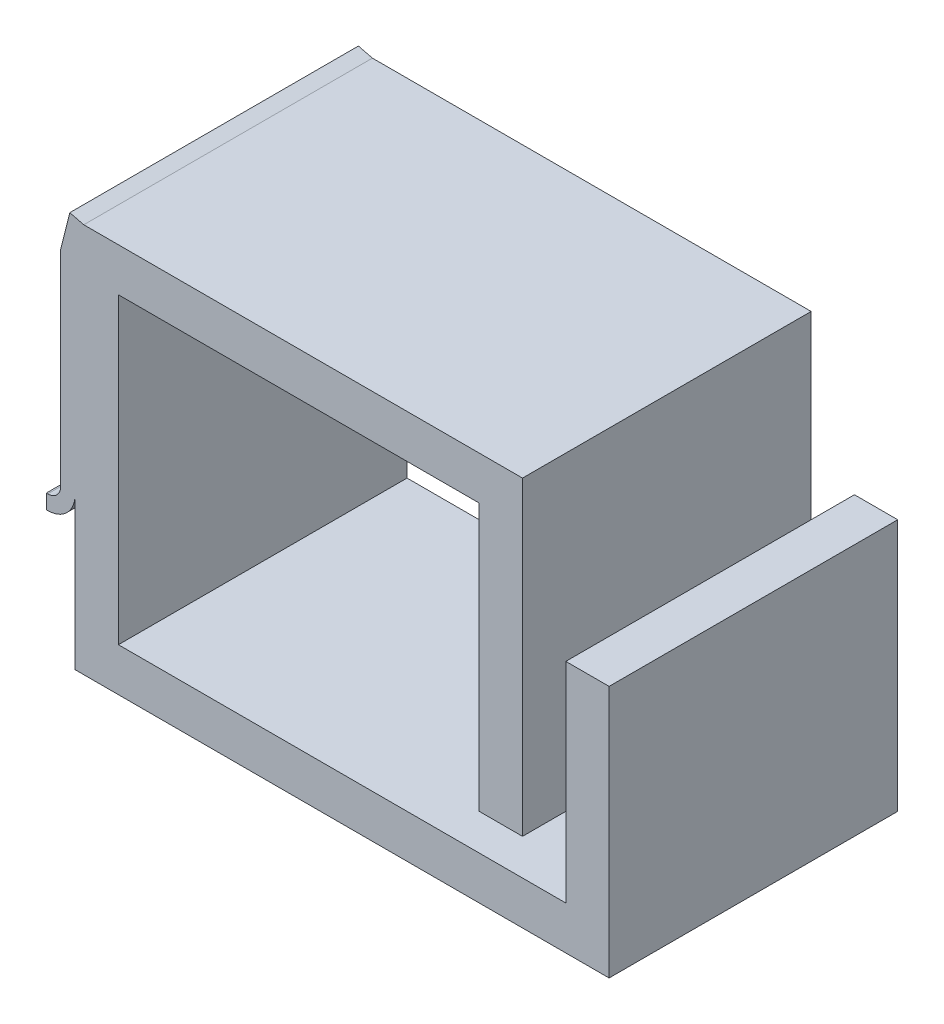
from build123d import *

# Parameters (mm, degrees)
EXTRUDE_THIN1_DEPTH = 10
EXTRUDE_THIN2_DEPTH = 10


# Read off the part's stored shape, not the designer's step: Extrude-Thin1
with BuildPart() as part:
    # Extrude-Thin1 outline → Extrude-Thin1 (new body)
    with BuildSketch(Plane.XY):
        Polygon((-9.314102564, -0.45), (-9.314102564, -12.75), (9.185897436, -12.75), (9.185897436, -4), (7.685897436, -4), (7.685897436, -11.25), (-7.814102564, -11.25), (-7.814102564, -0.75), (4.685897436, -0.75), (4.685897436, -10), (6.185897436, -10), (6.185897436, 0.75), (-9.014102564, 0.75), align=None)
    extrude(amount=EXTRUDE_THIN1_DEPTH)

    # Sketch2 → Extrude-Thin2 (add)
    with BuildSketch(Plane.XY.offset(10)):
        with BuildLine():
            Line((-9.014102564, 0.75), (-9.314102564, -0.45))
            Line((-9.314102564, -0.45), (-9.314102564, -7.5))
            ThreePointArc((-9.314102564, -7.5), (-9.592351122, -8.171751442), (-10.264102564, -8.45))
            Line((-10.264102564, -8.45), (-10.314102564, -8.45))
            Line((-10.314102564, -8.45), (-10.314102564, -7.95))
            Line((-10.314102564, -7.95), (-10.264102564, -7.95))
            ThreePointArc((-10.264102564, -7.95), (-9.945904513, -7.818198052), (-9.814102564, -7.5))
            Line((-9.814102564, -7.5), (-9.814102564, -0.388447187))
            Line((-9.814102564, -0.388447187), (-9.499173814, 0.871267813))
            Line((-9.499173814, 0.871267813), (-9.014102564, 0.75))
        make_face()
    extrude(amount=-EXTRUDE_THIN2_DEPTH)


solid = part.part
